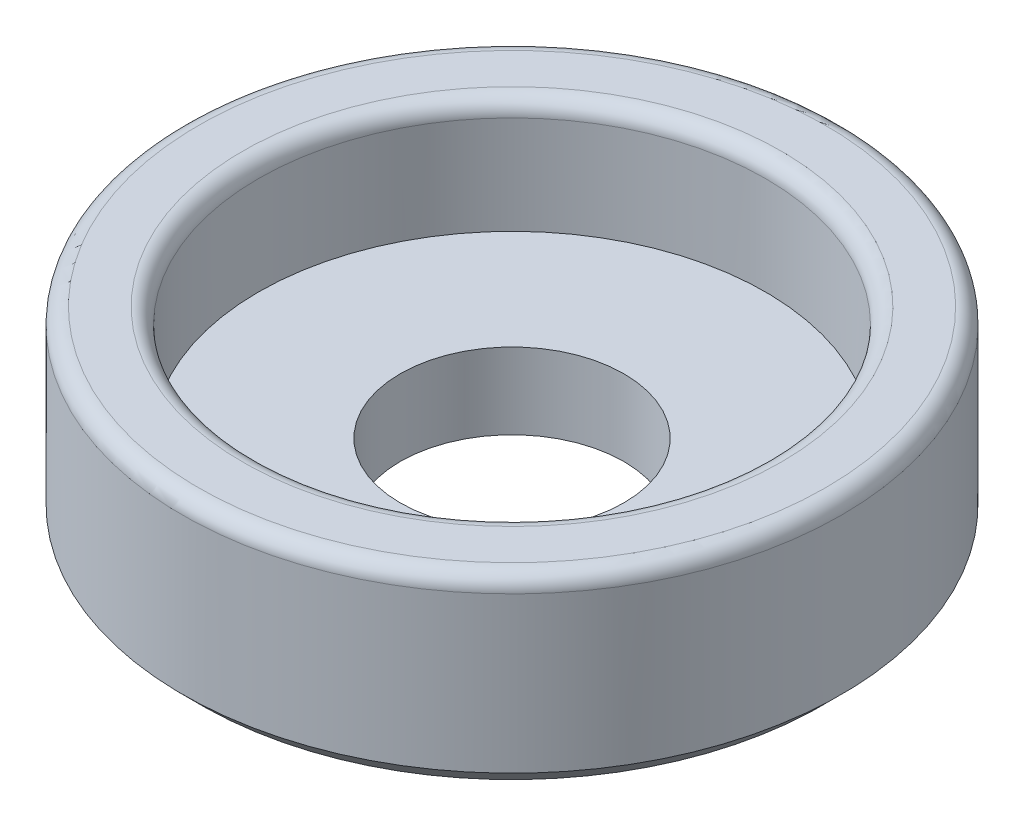
from build123d import *

# Parameters (mm, degrees)
SKETCH2_R          = 1.765
CUT_EXTRUDE1_DEPTH = 8.570997292
FILLET1_R          = 0.25
CHAMFER1_SIZE      = 0.3


with BuildPart() as part:
    # Sketch1 → Revolve1 (revolve)
    with BuildSketch(Plane.XY):
        Polygon((0, 0), (5.2, 0), (5.2, 3), (4, 3), (4, 1.2), (0, 1.2), align=None)
    revolve(axis=Axis((0, 1.2, 0), (0, -1, 0)))

    # Sketch2 → Cut-Extrude1 (cut, through all)
    with BuildSketch(Plane(origin=(0, 1.2, 0), x_dir=(1, 0, 0), z_dir=(0, 1, 0))):
        Circle(SKETCH2_R)
    extrude(amount=-CUT_EXTRUDE1_DEPTH, mode=Mode.SUBTRACT)

    # Fillet1
    fillet1_edges = [part.edges().sort_by_distance(p)[0] for p in [
        (-4, 3, 0),
        (-5.2, 3, 0),
    ]]
    fillet(fillet1_edges, radius=FILLET1_R)

    # Chamfer1
    chamfer1_edges = [part.edges().sort_by_distance(p)[0] for p in [
        (-5.2, 0, 0),
    ]]
    chamfer(chamfer1_edges, length=CHAMFER1_SIZE)


solid = part.part
